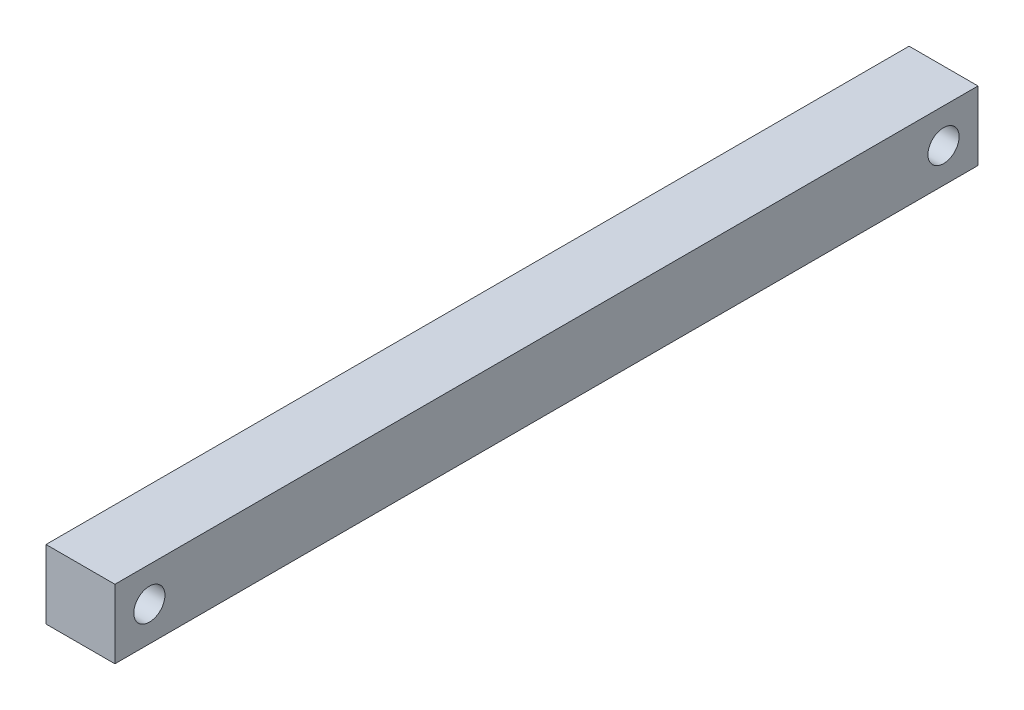
from build123d import *

# Parameters (mm, degrees)
SKETCH1_W           = 9.525
SKETCH1_H           = 9.525
BOSS_EXTRUDE1_DEPTH = 119.297492001
SKETCH3_R           = 2.15265
CUT_EXTRUDE1_DEPTH  = 120.771860756


with BuildPart() as part:
    # Sketch1 → Boss-Extrude1 (new body)
    with BuildSketch(Plane.XY):
        Rectangle(SKETCH1_W, SKETCH1_H)
    extrude(amount=BOSS_EXTRUDE1_DEPTH)

    # Sketch3 → Cut-Extrude1 (cut, through all)
    with BuildSketch(Plane(origin=(4.7625, 0, 0), x_dir=(0, 0, -1), z_dir=(1, 0, 0))):
        with Locations((-4.7625, 0)):
            Circle(SKETCH3_R)
    cut_extrude1 = extrude(amount=-CUT_EXTRUDE1_DEPTH, mode=Mode.SUBTRACT)

    # Mirror1: Cut-Extrude1 across plane
    add(cut_extrude1.mirror(Plane(origin=(0, 0, 59.648746), x_dir=(1, 0, 0), z_dir=(0, 0, -1))), mode=Mode.SUBTRACT)


solid = part.part
